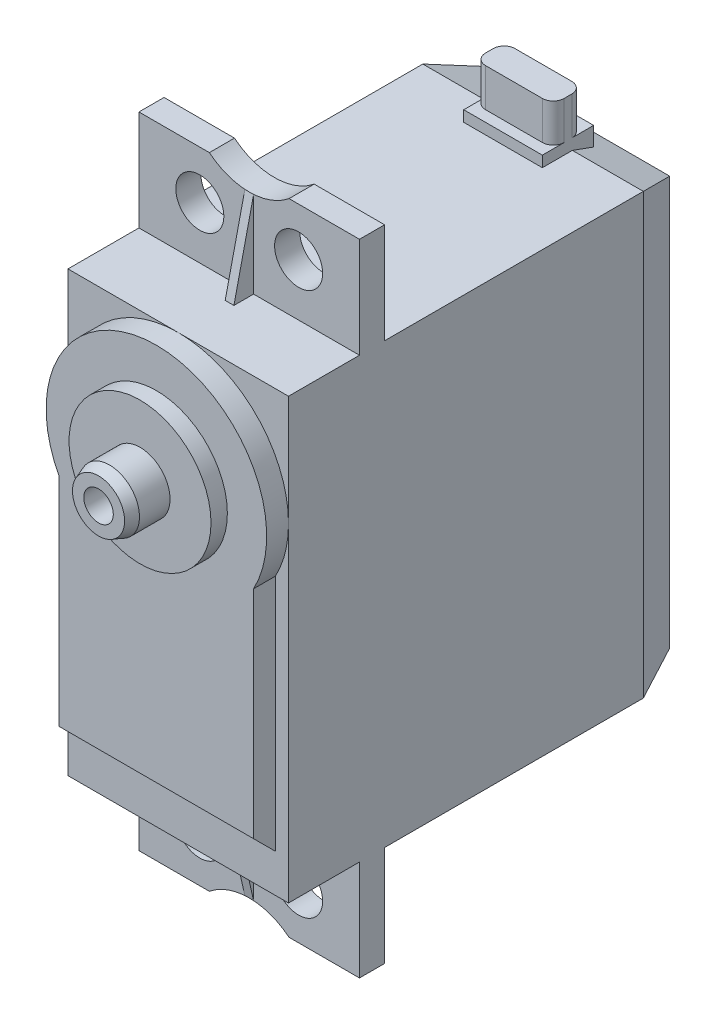
from build123d import *
from OCP.BRepFilletAPI import BRepFilletAPI_MakeChamfer

# Parameters (mm, degrees)
BOSS_EXTRUDE1_DEPTH      = 10.1
BOSS_EXTRUDE1_DEPTH_BACK = 10.1
CUT_EXTRUDE1_REACH       = 44.995
SKETCH2_R                = 2.2
RIB3_REACH               = 43.434
SKETCH3_WALL_W           = 92.969832662
SKETCH3_WALL_H           = 0.8
BOSS_EXTRUDE2_DEPTH      = 2
CHAMFER1_SIZE            = 2
SKETCH5_R                = 6.5
BOSS_EXTRUDE3_DEPTH      = 1.5
CHAMFER2_SIZE            = 3.8
CHAMFER2_SIZE2           = 1.38308689
BOSS_EXTRUDE4_DEPTH      = 3.6
BOSS_EXTRUDE4_DEPTH_BACK = 3.6
FILLET2_R                = 1
SKETCH7_R                = 2.75
SKETCH7_R_2              = 1.35
BOSS_EXTRUDE5_DEPTH      = 3.8
CHAMFER3_SIZE            = 1
CHAMFER3_SIZE2           = 0.363970234


with BuildPart() as part:
    # Sketch1 → Boss-Extrude1 (new, two sides: drawn at the far end of the back side and taken through both)
    with BuildSketch(Plane(origin=(0, 0, 0), x_dir=(0, 0, -1), z_dir=(1, 0, 0)).offset(-BOSS_EXTRUDE1_DEPTH_BACK)):
        Polygon((-8.8, -20.1), (-8.8, 20.1), (-2.3, 20.1), (-2.3, 29.3), (0, 29.3), (0, 20.1), (27.5, 20.1), (27.5, -20.1), (0, -20.1), (0, -29.3), (-2.3, -29.3), (-2.3, -20.1), align=None)
    extrude(amount=BOSS_EXTRUDE1_DEPTH + BOSS_EXTRUDE1_DEPTH_BACK)

    # Sketch2 → Cut-Extrude1 (cut, up to next)
    with BuildSketch(Plane.XY.offset(2.3), mode=Mode.PRIVATE) as cut_extrude1_sk1:
        with Locations((4.525, 24.9)):
            Circle(SKETCH2_R)
    cut_extrude1_tool1 = extrude(cut_extrude1_sk1.sketch, amount=-CUT_EXTRUDE1_REACH, mode=Mode.PRIVATE) & part.part
    # Sketch2 → Cut-Extrude1 (cut, up to next)
    with BuildSketch(Plane.XY.offset(2.3), mode=Mode.PRIVATE) as cut_extrude1_sk2:
        with Locations(Location((-4.525, 24.9, 0), (0, 0, 90))):
            Circle(SKETCH2_R)
    cut_extrude1_tool2 = extrude(cut_extrude1_sk2.sketch, amount=-CUT_EXTRUDE1_REACH, mode=Mode.PRIVATE) & part.part
    # Sketch2 → Cut-Extrude1 (cut, up to next)
    with BuildSketch(Plane.XY.offset(2.3), mode=Mode.PRIVATE) as cut_extrude1_sk3:
        with Locations((-4.525, -24.9)):
            Circle(SKETCH2_R)
    cut_extrude1_tool3 = extrude(cut_extrude1_sk3.sketch, amount=-CUT_EXTRUDE1_REACH, mode=Mode.PRIVATE) & part.part
    # Sketch2 → Cut-Extrude1 (cut, up to next)
    with BuildSketch(Plane.XY.offset(2.3), mode=Mode.PRIVATE) as cut_extrude1_sk4:
        with Locations(Location((4.525, -24.9, 0), (0, 0, 90))):
            Circle(SKETCH2_R)
    cut_extrude1_tool4 = extrude(cut_extrude1_sk4.sketch, amount=-CUT_EXTRUDE1_REACH, mode=Mode.PRIVATE) & part.part
    # Sketch2 → Cut-Extrude1 (cut, up to next)
    with BuildSketch(Plane.XY.offset(2.3), mode=Mode.PRIVATE) as cut_extrude1_sk5:
        with BuildLine():
            Line((-3.65, 29.3), (3.65, 29.3))
            ThreePointArc((3.65, 29.3), (0, 28), (-3.65, 29.3))
        make_face()
    cut_extrude1_tool5 = extrude(cut_extrude1_sk5.sketch, amount=-CUT_EXTRUDE1_REACH, mode=Mode.PRIVATE) & part.part
    # Sketch2 → Cut-Extrude1 (cut, up to next)
    with BuildSketch(Plane.XY.offset(2.3), mode=Mode.PRIVATE) as cut_extrude1_sk6:
        with BuildLine():
            Line((-3.65, -29.3), (3.65, -29.3))
            ThreePointArc((3.65, -29.3), (0, -28), (-3.65, -29.3))
        make_face()
    cut_extrude1_tool6 = extrude(cut_extrude1_sk6.sketch, amount=-CUT_EXTRUDE1_REACH, mode=Mode.PRIVATE) & part.part
    add(cut_extrude1_tool1.solids().sort_by_distance((4.525, 24.9, 2.3))[0], mode=Mode.SUBTRACT)
    add(cut_extrude1_tool2.solids().sort_by_distance((-4.525, 24.9, 2.3))[0], mode=Mode.SUBTRACT)
    add(cut_extrude1_tool3.solids().sort_by_distance((-4.525, -24.9, 2.3))[0], mode=Mode.SUBTRACT)
    add(cut_extrude1_tool4.solids().sort_by_distance((4.525, -24.9, 2.3))[0], mode=Mode.SUBTRACT)
    add(cut_extrude1_tool5.solids().sort_by_distance((0, 28.774631, 2.3))[0], mode=Mode.SUBTRACT)
    add(cut_extrude1_tool6.solids().sort_by_distance((0, -28.774631, 2.3))[0], mode=Mode.SUBTRACT)

    # Sketch3 wall → Rib3 (add, up to next)
    with BuildSketch(Plane(origin=(0, 24.05, 3.2), x_dir=(0, -0.975011472973, 0.222154512829), z_dir=(0, -0.222154512829, -0.975011472973)), mode=Mode.PRIVATE) as rib3_sk1:
        Rectangle(SKETCH3_WALL_W, SKETCH3_WALL_H)
    rib3_tool1 = extrude(rib3_sk1.sketch, amount=RIB3_REACH, mode=Mode.PRIVATE) - part.part
    rib3 = rib3_tool1.solids().sort_by_distance((0, 24.05, 3.2))[0]
    add(rib3)

    # Mirror1: Rib3 across plane
    add(rib3.mirror(Plane.ZX))

    # Sketch4 → Boss-Extrude2 (add)
    with BuildSketch(Plane.XY.offset(8.8)):
        with BuildLine():
            Line((8.9, 5.225065445), (8.9, -16.6))
            Line((8.9, -16.6), (-8.9, -16.6))
            Line((-8.9, -16.6), (-8.9, 5.225065445))
            ThreePointArc((-8.9, 5.225065445), (0, 20.1), (8.9, 5.225065445))
        make_face()
    extrude(amount=BOSS_EXTRUDE2_DEPTH)

    # Chamfer1
    chamfer1_edges = [part.edges().sort_by_distance(p)[0] for p in [
        (0, -16.6, 10.8),
    ]]
    chamfer(chamfer1_edges, length=CHAMFER1_SIZE - 0.0001)  # a hair under: the kernel refuses the full size

    # Sketch5 → Boss-Extrude3 (add)
    with BuildSketch(Plane.XY.offset(10.8)):
        with Locations((0, 10)):
            Circle(SKETCH5_R)
    extrude(amount=BOSS_EXTRUDE3_DEPTH)

    # Chamfer2: one chamfer whose edges measure the first distance from different faces: ONE call of the kernel's chamfer builder (chamfer() names one face for all edges)
    chamfer2_edges_1 = [part.edges().sort_by_distance(p)[0] for p in [
        (-10.1, 0, -27.5),
    ]]
    chamfer2_side_1 = [part.faces().sort_by_distance(p)[0] for p in [
        (-10.1, 0, -9.054071711),
    ]]
    chamfer2_edges_2 = [part.edges().sort_by_distance(p)[0] for p in [
        (0, 20.1, -27.5),
    ]]
    chamfer2_side_2 = [part.faces().sort_by_distance(p)[0] for p in [
        (0, 20.1, -13.75),
    ]]
    chamfer2_edges_3 = [part.edges().sort_by_distance(p)[0] for p in [
        (0, -20.1, -27.5),
    ]]
    chamfer2_side_3 = [part.faces().sort_by_distance(p)[0] for p in [
        (0, -20.1, -13.75),
    ]]
    chamfer2_edges_4 = [part.edges().sort_by_distance(p)[0] for p in [
        (10.1, 0, -27.5),
    ]]
    chamfer2_side_4 = [part.faces().sort_by_distance(p)[0] for p in [
        (10.1, 0, -9.054071711),
    ]]
    chamfer2 = BRepFilletAPI_MakeChamfer(part.part.solid().wrapped)
    for e in chamfer2_edges_1:
        chamfer2.Add(CHAMFER2_SIZE, CHAMFER2_SIZE2, e.wrapped, chamfer2_side_1[0].wrapped)  # the first distance lies on this face
    for e in chamfer2_edges_2:
        chamfer2.Add(CHAMFER2_SIZE, CHAMFER2_SIZE2, e.wrapped, chamfer2_side_2[0].wrapped)  # the first distance lies on this face
    for e in chamfer2_edges_3:
        chamfer2.Add(CHAMFER2_SIZE, CHAMFER2_SIZE2, e.wrapped, chamfer2_side_3[0].wrapped)  # the first distance lies on this face
    for e in chamfer2_edges_4:
        chamfer2.Add(CHAMFER2_SIZE, CHAMFER2_SIZE2, e.wrapped, chamfer2_side_4[0].wrapped)  # the first distance lies on this face
    add(Compound.cast(chamfer2.Shape()), mode=Mode.REPLACE)

    # Sketch6 → Boss-Extrude4 (add, two sides: drawn at the far end of the back side and taken through both)
    with BuildSketch(Plane(origin=(0, 0, 0), x_dir=(0, 0, -1), z_dir=(1, 0, 0)).offset(-BOSS_EXTRUDE4_DEPTH_BACK)):
        Polygon((25.65, 18.71691311), (20.95, 18.71691311), (20.95, 21.1), (21.95, 21.1), (21.95, 24.6), (24.65, 24.6), (24.65, 21.110599186), (25.65, 21.110599186), align=None)
    extrude(amount=BOSS_EXTRUDE4_DEPTH + BOSS_EXTRUDE4_DEPTH_BACK)

    # Fillet2
    fillet2_edges = [part.edges().sort_by_distance(p)[0] for p in [
        (-3.6, 22.85, -21.95),
        (-3.6, 22.855299593, -24.65),
        (3.6, 22.855299593, -24.65),
        (3.6, 22.85, -21.95),
    ]]
    fillet(fillet2_edges, radius=FILLET2_R)

    # Sketch7 → Boss-Extrude5 (add)
    with BuildSketch(Plane.XY.offset(12.3)):
        with Locations(Location((0, 10, 0), (0, 0, 180))):
            Circle(SKETCH7_R)
        with Locations(Location((0, 10, 0), (0, 0, 180))):
            Circle(SKETCH7_R_2, mode=Mode.SUBTRACT)
    extrude(amount=BOSS_EXTRUDE5_DEPTH)

    # Chamfer3
    chamfer3_edges = [part.edges().sort_by_distance(p)[0] for p in [
        (2.75, 10, 16.1),
    ]]
    chamfer3_side = [part.faces().sort_by_distance(p)[0] for p in [
        (2.75, 10, 14.2),
    ]]
    chamfer(chamfer3_edges, length=CHAMFER3_SIZE, length2=CHAMFER3_SIZE2, reference=chamfer3_side[0])


solid = part.part
